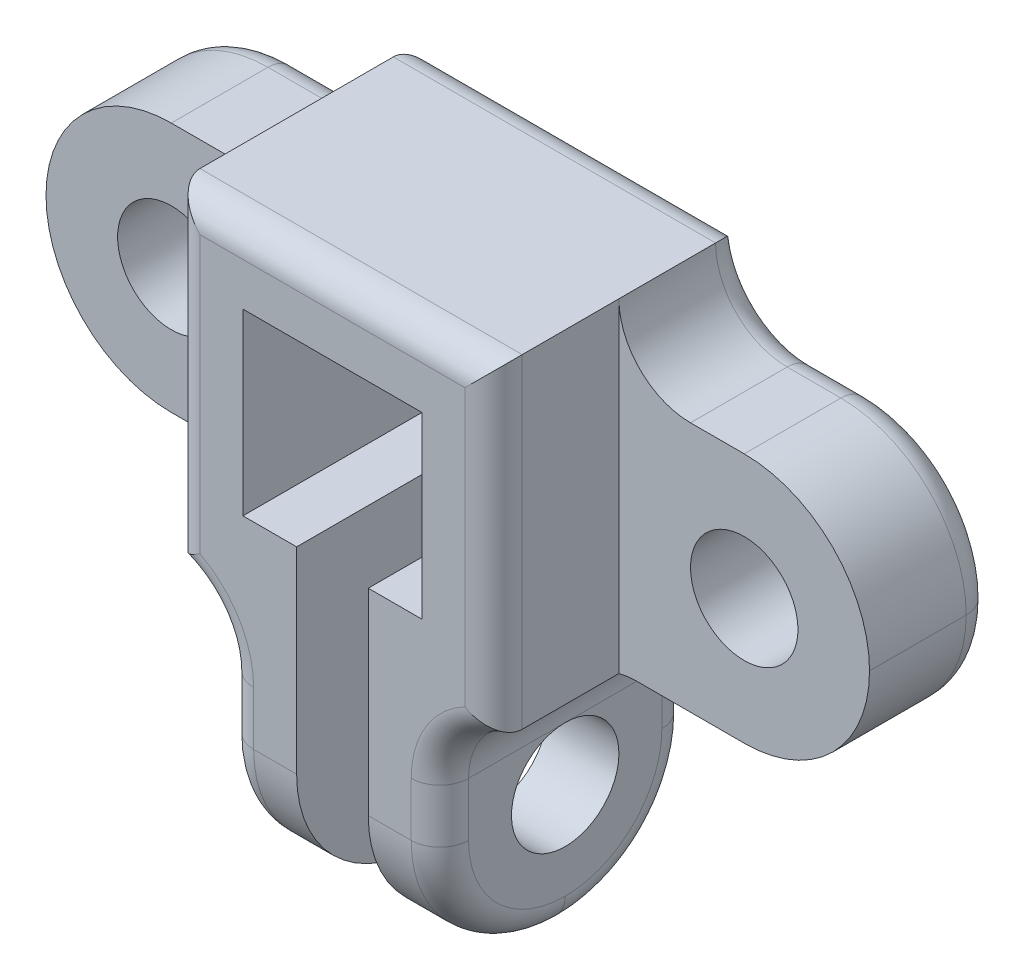
from build123d import *

# Parameters (mm, degrees)
EXTRUDE_1_DEPTH     = 7
CUT_EXTRUDE_1_DEPTH = 3.5
FILLET_1_R          = 3.5
SKETCH_3_R          = 1.4999999999999996
CUT_EXTRUDE_2_DEPTH = 17.635804759614125
SKETCH_4_R          = 1.5000000000000002
CUT_EXTRUDE_3_DEPTH = 20.786358937409375
FILLET_2_R          = 2
FILLET_3_R          = 2
FILLET_4_R          = 0.8


# Some blends are built 0.0001 mm under size
with BuildPart() as part:
    # 草图1 → 凸台-拉伸1 (new body)
    with BuildSketch(Plane.XY):
        Polygon((-2.5000000000000004, -2.4999999999999996), (-2.5000000000000013, 2.5000000000000004), (-4.499999999999999, 2.4999999999999996), (-4.499999999999999, -4.500000000000002), (-2.9999999999999973, -4.500000000000002), (-0.9999999999999982, -4.500000000000002), (-0.9999999999999986, -2.4999999999999987), align=None)
        Polygon((-4.499999999999999, 2.4999999999999996), (-2.5000000000000013, 2.5000000000000004), (2.4999999999999987, 2.5000000000000004), (4.500000000000001, 2.4999999999999996), (4.500000000000001, 4.499999999999998), (-4.499999999999999, 4.499999999999998), align=None)
        Polygon((4.500000000000001, 2.4999999999999996), (2.4999999999999987, 2.5000000000000004), (2.4999999999999996, -2.4999999999999996), (0.9999999999999987, -2.4999999999999996), (0.9999999999999982, -4.500000000000002), (2.9999999999999973, -4.500000000000002), (4.500000000000001, -4.500000000000002), align=None)
        Polygon((-0.9999999999999982, -4.500000000000002), (-2.9999999999999973, -4.500000000000002), (-2.9999999999999973, -11.500000000000004), (-0.9999999999999972, -11.500000000000004), align=None)
        Polygon((2.9999999999999973, -4.500000000000002), (0.9999999999999982, -4.500000000000002), (0.9999999999999972, -11.500000000000004), (2.9999999999999973, -11.500000000000004), align=None)
        Polygon((-4.499999999999999, -4.500000000000002), (-4.499999999999999, 2.4999999999999996), (-11.499999999999996, 2.499999999999997), (-11.499999999999996, -4.5000000000000036), align=None)
        Polygon((11.499999999999996, 2.499999999999997), (4.500000000000001, 2.4999999999999996), (4.500000000000002, -4.500000000000002), (11.499999999999996, -4.5000000000000036), align=None)
    extrude(amount=EXTRUDE_1_DEPTH)

    # 草图2 → 切除-拉伸1 (cut)
    with BuildSketch(Plane.XY.offset(7)):
        Polygon((-4.499999999999999, 2.4999999999999996), (-4.499999999999999, -4.500000000000002), (-11.499999999999996, -4.5000000000000036), (-11.499999999999996, 2.499999999999997), align=None)
        Polygon((4.500000000000001, 2.5), (4.500000000000001, -4.500000000000002), (11.499999999999996, -4.5000000000000036), (11.499999999999996, 2.499999999999997), align=None)
    extrude(amount=-CUT_EXTRUDE_1_DEPTH, mode=Mode.SUBTRACT)

    # 圆角1
    fillet_1_edges = [part.edges().sort_by_distance(p)[0] for p in [
        (1.9999999999999973, -11.500000000000004, 0),
        (1.9999999999999973, -11.500000000000004, 7),
        (-1.9999999999999973, -11.500000000000004, 0),
        (-1.9999999999999973, -11.500000000000004, 7),
        (11.499999999999996, -4.5000000000000036, 1.75),
        (11.499999999999996, 2.499999999999997, 1.75),
        (-11.499999999999996, -4.5000000000000036, 1.75),
        (-11.499999999999996, 2.499999999999997, 1.75),
    ]]
    fillet(fillet_1_edges, radius=FILLET_1_R - 0.0001)  # a hair under: the kernel refuses the full size

    # 草图3 → 切除-拉伸2 (cut, through all)
    with BuildSketch(Plane.XY.offset(3.5)):
        with Locations((-7.9999999999999964, -1.0000000000000013)):
            Circle(SKETCH_3_R)
        with Locations(Location((7.9999999999999964, -1.0000000000000013, 0), (0, 0, 180))):
            Circle(SKETCH_3_R)
    extrude(amount=-CUT_EXTRUDE_2_DEPTH, mode=Mode.SUBTRACT)

    # 草图4 → 切除-拉伸3 (cut, through all)
    with BuildSketch(Plane.ZY.offset(2.9999999999999973)):
        with Locations((3.5, -8.000000000000004)):
            Circle(SKETCH_4_R)
    extrude(amount=-CUT_EXTRUDE_3_DEPTH, mode=Mode.SUBTRACT)

    # 圆角2
    fillet_2_edges = [part.edges().sort_by_distance(p)[0] for p in [
        (4.500000000000001, 2.4999999999999996, 1.75),
        (-4.499999999999999, 2.4999999999999996, 1.75),
    ]]
    fillet(fillet_2_edges, radius=FILLET_2_R - 0.0001)  # a hair under: the kernel refuses the full size

    # 圆角3
    fillet_3_edges = [part.edges().sort_by_distance(p)[0] for p in [
        (2.9999999999999973, -4.500000000000002, 3.5),
        (-2.9999999999999973, -4.500000000000002, 3.5),
    ]]
    fillet(fillet_3_edges, radius=FILLET_3_R)

    # 圆角4
    # the kernel refuses this fillet: 0.8 mm, written as the material it takes off along each edge
    with BuildSketch(Plane(origin=(-2.9999999999999973, -6.500000000000002, 0), x_dir=(1, 0, 0), z_dir=(0, -1, 0))) as fillet_4_piece_1:
        with BuildLine():
            CenterArc((FILLET_4_R, FILLET_4_R), FILLET_4_R, 180, 90)
            Line((0, FILLET_4_R), (0, 0))
            Line((0, 0), (FILLET_4_R, 0))
        make_face()
    extrude(amount=1.5001000000000015, mode=Mode.SUBTRACT)
    with BuildSketch(Plane(origin=(-4.9999999999999964, -4.500000000000002, 0), x_dir=(-2.1e-16, 1, 0), z_dir=(-1, -2.1e-16, 0)), Plane(origin=(8.000099999999996, -4.500000000000003, 0), x_dir=(2.1e-16, 1, 0), z_dir=(-1, 2.1e-16, 0))) as fillet_4_piece_2:
        with BuildLine():
            CenterArc((FILLET_4_R, -FILLET_4_R), FILLET_4_R, 90, 90)
            Line((0, -FILLET_4_R), (0, 0))
            Line((0, 0), (FILLET_4_R, 0))
        make_face()
    extrude(amount=3.0000999999999998, mode=Mode.SUBTRACT)
    with BuildSketch(Plane(origin=(-8.000099999999996, -0.9999000000000016, 0), x_dir=(-1, -6e-17, 0), z_dir=(6e-17, -1, 0))) as fillet_4_piece_3:
        with BuildLine():
            CenterArc((3.4999000000000002 - FILLET_4_R, -FILLET_4_R), FILLET_4_R, 7.95e-15, 90)
            Line((3.4999000000000002, -FILLET_4_R), (3.4999000000000002, 0))
            Line((3.4999000000000002, 0), (3.4999000000000002 - FILLET_4_R, 0))
        make_face()
    revolve(axis=Axis((-8.000099999999996, -0.9999000000000016, 0), (0, 0, -1)), revolution_arc=90, mode=Mode.SUBTRACT)
    with BuildSketch(Plane(origin=(-8.000099999999996, -1.0001000000000024, 0), x_dir=(0, -1, 0), z_dir=(1, 0, 0))) as fillet_4_piece_4:
        with BuildLine():
            CenterArc((3.4998999999999993 - FILLET_4_R, -FILLET_4_R), FILLET_4_R, 7.95e-15, 90)
            Line((3.4998999999999993, -FILLET_4_R), (3.4998999999999993, 0))
            Line((3.4998999999999993, 0), (3.4998999999999993 - FILLET_4_R, 0))
        make_face()
    revolve(axis=Axis((-8.000099999999996, -1.0001000000000024, 0), (0, 0, -1)), revolution_arc=90, mode=Mode.SUBTRACT)
    with BuildSketch(Plane(origin=(8.000099999999996, -0.999900000000002, 0), x_dir=(1, -6e-17, 0), z_dir=(-6e-17, -1, 0))) as fillet_4_piece_5:
        with BuildLine():
            CenterArc((3.4999000000000002 - FILLET_4_R, FILLET_4_R), FILLET_4_R, 270, 89.99999999999999)
            Line((3.4999000000000002, FILLET_4_R), (3.4999000000000002, 0))
            Line((3.4999000000000002, 0), (3.4999000000000002 - FILLET_4_R, 0))
        make_face()
    revolve(axis=Axis((8.000099999999996, -0.999900000000002, 0), (0, 0, 1)), revolution_arc=89.99999999999997, mode=Mode.SUBTRACT)
    with BuildSketch(Plane(origin=(8.000099999999996, -1.0001000000000024, 0), x_dir=(1, 1.9e-16, 0), z_dir=(-1.9e-16, 1, 0))) as fillet_4_piece_6:
        with BuildLine():
            CenterArc((3.4999000000000002 - FILLET_4_R, -FILLET_4_R), FILLET_4_R, 7.95e-15, 90)
            Line((3.4999000000000002, -FILLET_4_R), (3.4999000000000002, 0))
            Line((3.4999000000000002, 0), (3.4999000000000002 - FILLET_4_R, 0))
        make_face()
    revolve(axis=Axis((8.000099999999996, -1.0001000000000024, 0), (0, 0, -1)), revolution_arc=90, mode=Mode.SUBTRACT)
    with BuildSketch(Plane(origin=(-2.9999999999999973, -6.500000000000002, 7), x_dir=(1, 0, 0), z_dir=(0, -1, 0))) as fillet_4_piece_7:
        with BuildLine():
            CenterArc((FILLET_4_R, -FILLET_4_R), FILLET_4_R, 90, 90)
            Line((0, -FILLET_4_R), (0, 0))
            Line((0, 0), (FILLET_4_R, 0))
        make_face()
    extrude(amount=1.5001000000000015, mode=Mode.SUBTRACT)
    with BuildSketch(Plane(origin=(-2.9999999999999973, -8.000100000000003, 3.5001000000000007), x_dir=(0, 0, 1), z_dir=(0, 1, 0))) as fillet_4_piece_8:
        with BuildLine():
            CenterArc((3.4998999999999993 - FILLET_4_R, FILLET_4_R), FILLET_4_R, 270, 90)
            Line((3.4998999999999993, FILLET_4_R), (3.4998999999999993, 0))
            Line((3.4998999999999993, 0), (3.4998999999999993 - FILLET_4_R, 0))
        make_face()
    revolve(axis=Axis((-2.9999999999999973, -8.000100000000003, 3.5001000000000007), (1, 0, 0)), revolution_arc=90, mode=Mode.SUBTRACT)
    with BuildSketch(Plane(origin=(-2.9999999999999973, -8.000100000000003, 3.4998999999999993), x_dir=(0, -1, 0), z_dir=(0, 0, 1))) as fillet_4_piece_9:
        with BuildLine():
            CenterArc((3.4999000000000002 - FILLET_4_R, FILLET_4_R), FILLET_4_R, 270, 90)
            Line((3.4999000000000002, FILLET_4_R), (3.4999000000000002, 0))
            Line((3.4999000000000002, 0), (3.4999000000000002 - FILLET_4_R, 0))
        make_face()
    revolve(axis=Axis((-2.9999999999999973, -8.000100000000003, 3.4998999999999993), (1, 0, 0)), revolution_arc=90, mode=Mode.SUBTRACT)
    with BuildSketch(Plane(origin=(8.000099999999998, 2.4999999999999982, 0), x_dir=(-3.8e-16, -1, 0), z_dir=(-1, 3.8e-16, 0))) as fillet_4_piece_10:
        with BuildLine():
            CenterArc((FILLET_4_R, FILLET_4_R), FILLET_4_R, 180, 90)
            Line((0, FILLET_4_R), (0, 0))
            Line((0, 0), (FILLET_4_R, 0))
        make_face()
    extrude(amount=1.5001999999999978, mode=Mode.SUBTRACT)
    with BuildSketch(Plane(origin=(-6.4998999999999985, 2.4999999999999987, 0), x_dir=(3.8e-16, -1, 0), z_dir=(-1, -3.8e-16, 0))) as fillet_4_piece_11:
        with BuildLine():
            CenterArc((FILLET_4_R, FILLET_4_R), FILLET_4_R, 180, 90)
            Line((-4.4e-16, FILLET_4_R), (0, 0))
            Line((0, 0), (FILLET_4_R, 0))
        make_face()
    extrude(amount=1.5001999999999978, mode=Mode.SUBTRACT)
    with BuildSketch(Plane(origin=(6.499900000000001, 4.4998999999999985, 0), x_dir=(-1, 0, 0), z_dir=(0, 1, 0))) as fillet_4_piece_12:
        with BuildLine():
            CenterArc((1.9999000000000002 + FILLET_4_R, FILLET_4_R), FILLET_4_R, 180, 90)
            Line((1.9999000000000002, FILLET_4_R), (1.9999000000000002, 0))
            Line((1.9999000000000002, 0), (1.9999000000000002 + FILLET_4_R, 0))
        make_face()
    revolve(axis=Axis((6.499900000000001, 4.4998999999999985, 0), (0, 0, 1)), revolution_arc=89.99999999999994, mode=Mode.SUBTRACT)
    with BuildSketch(Plane(origin=(-6.499899999999999, 4.4998999999999985, 0), x_dir=(1, 0, 0), z_dir=(0, 1, 0))) as fillet_4_piece_13:
        with BuildLine():
            CenterArc((1.9999000000000002 + FILLET_4_R, -FILLET_4_R), FILLET_4_R, 90, 90)
            Line((1.9999000000000002, -FILLET_4_R), (1.9999000000000002, 0))
            Line((1.9999000000000002, 0), (1.9999000000000002 + FILLET_4_R, 0))
        make_face()
    revolve(axis=Axis((-6.499899999999999, 4.4998999999999985, 0), (0, 0, -1)), revolution_arc=89.99999999999994, mode=Mode.SUBTRACT)
    with BuildSketch(Plane(origin=(4.9999999999999964, -6.500000000000002, 0), x_dir=(-1, 0, 0), z_dir=(0, -1, 0))) as fillet_4_piece_14:
        with BuildLine():
            CenterArc((2 + FILLET_4_R, -FILLET_4_R), FILLET_4_R, 90, 90)
            Line((1.9999999999999991, -FILLET_4_R), (2, 0))
            Line((2, 0), (2 + FILLET_4_R, 0))
        make_face()
    revolve(axis=Axis((4.9999999999999964, -6.500000000000002, 0), (0, 0, -1)), revolution_arc=90, mode=Mode.SUBTRACT)
    with BuildSketch(Plane(origin=(4.9999999999999964, -6.500000000000002, 7), x_dir=(-1, 0, 0), z_dir=(0, -1, 0))) as fillet_4_piece_15:
        with BuildLine():
            CenterArc((2 + FILLET_4_R, FILLET_4_R), FILLET_4_R, 180, 90)
            Line((1.9999999999999991, FILLET_4_R), (2, 0))
            Line((2, 0), (2 + FILLET_4_R, 0))
        make_face()
    revolve(axis=Axis((4.9999999999999964, -6.500000000000002, 7), (0, 0, -1)), revolution_arc=132.8344729120862, mode=Mode.SUBTRACT)
    with BuildSketch(Plane(origin=(-4.9999999999999964, -6.500000000000002, 0), x_dir=(0, 1, 0), z_dir=(-1, 0, 0))) as fillet_4_piece_16:
        with BuildLine():
            CenterArc((2 + FILLET_4_R, -FILLET_4_R), FILLET_4_R, 90, 90)
            Line((2 + FILLET_4_R, 1.1e-16), (2, 0))
            Line((2, 0), (2, -FILLET_4_R))
        make_face()
    revolve(axis=Axis((-4.9999999999999964, -6.500000000000002, 0), (0, 0, -1)), revolution_arc=90, mode=Mode.SUBTRACT)
    with BuildSketch(Plane(origin=(-4.9999999999999964, -6.500000000000002, 7), x_dir=(-0.679882641435008, 0.7333209351132398, 0), z_dir=(-0.7333209351132398, -0.679882641435008, 0))) as fillet_4_piece_17:
        with BuildLine():
            CenterArc((1.9999999999999993 + FILLET_4_R, FILLET_4_R), FILLET_4_R, 180, 90)
            Line((1.9999999999999991, FILLET_4_R), (1.9999999999999993, 0))
            Line((1.9999999999999993, 0), (1.9999999999999993 + FILLET_4_R, 0))
        make_face()
    revolve(axis=Axis((-4.9999999999999964, -6.500000000000002, 7), (0, 0, -1)), revolution_arc=132.83447291208606, mode=Mode.SUBTRACT)
    with BuildSketch(Plane(origin=(6.500000000000002, 4.499999999999998, 0), x_dir=(0, 0, 1), z_dir=(-1, 0, 0))) as fillet_4_piece_18:
        with BuildLine():
            CenterArc((FILLET_4_R, -FILLET_4_R), FILLET_4_R, 90, 90)
            Line((-1.1e-16, -FILLET_4_R), (0, 0))
            Line((0, 0), (FILLET_4_R, 0))
        make_face()
    extrude(amount=13, mode=Mode.SUBTRACT)
    with BuildSketch(Plane(origin=(4.500000000000002, -6.563508326896292, 7), x_dir=(-1, 0, 0), z_dir=(0, 1, 0))) as fillet_4_piece_19:
        with BuildLine():
            CenterArc((FILLET_4_R, -FILLET_4_R), FILLET_4_R, 90, 90)
            Line((-8.9e-16, -FILLET_4_R), (0, 0))
            Line((0, 0), (FILLET_4_R, 0))
        make_face()
    extrude(amount=13.06350832689629, mode=Mode.SUBTRACT)
    with BuildSketch(Plane(origin=(6.500000000000002, 4.499999999999998, 7), x_dir=(0, -1, 0), z_dir=(-1, 0, 0))) as fillet_4_piece_20:
        with BuildLine():
            CenterArc((FILLET_4_R, -FILLET_4_R), FILLET_4_R, 90, 90)
            Line((0, -FILLET_4_R), (0, 0))
            Line((0, 0), (FILLET_4_R, 0))
        make_face()
    extrude(amount=13, mode=Mode.SUBTRACT)
    with BuildSketch(Plane(origin=(-4.499999999999999, 6.499999999999998, 7), x_dir=(0, 0, -1), z_dir=(0, -1, 0))) as fillet_4_piece_21:
        with BuildLine():
            CenterArc((FILLET_4_R, FILLET_4_R), FILLET_4_R, 180, 90)
            Line((0, FILLET_4_R), (0, 0))
            Line((0, 0), (FILLET_4_R, 0))
        make_face()
    extrude(amount=13.063508326896292, mode=Mode.SUBTRACT)
    with BuildSketch(Plane(origin=(2.9999999999999973, -8.000100000000003, 0), x_dir=(-1, 0, 0), z_dir=(0, 1, 0))) as fillet_4_piece_22:
        with BuildLine():
            CenterArc((FILLET_4_R, FILLET_4_R), FILLET_4_R, 180, 90)
            Line((0, FILLET_4_R), (0, 0))
            Line((0, 0), (FILLET_4_R, 0))
        make_face()
    extrude(amount=1.5001000000000015, mode=Mode.SUBTRACT)
    with BuildSketch(Plane(origin=(2.9999999999999973, -8.000100000000003, 7), x_dir=(-1, 0, 0), z_dir=(0, 1, 0))) as fillet_4_piece_23:
        with BuildLine():
            CenterArc((FILLET_4_R, -FILLET_4_R), FILLET_4_R, 90, 90)
            Line((0, -FILLET_4_R), (0, 0))
            Line((0, 0), (FILLET_4_R, 0))
        make_face()
    extrude(amount=1.5001000000000015, mode=Mode.SUBTRACT)
    with BuildSketch(Plane(origin=(2.9999999999999973, -8.000100000000003, 3.5001000000000007), x_dir=(0, 0, 1), z_dir=(0, 1, 0))) as fillet_4_piece_24:
        with BuildLine():
            CenterArc((3.4998999999999993 - FILLET_4_R, -FILLET_4_R), FILLET_4_R, 0, 90)
            Line((3.4998999999999993, -FILLET_4_R), (3.4998999999999993, 0))
            Line((3.4998999999999993, 0), (3.4998999999999993 - FILLET_4_R, 0))
        make_face()
    revolve(axis=Axis((2.9999999999999973, -8.000100000000003, 3.5001000000000007), (1, 0, 0)), revolution_arc=90, mode=Mode.SUBTRACT)
    with BuildSketch(Plane(origin=(2.9999999999999973, -8.000100000000003, 3.4998999999999993), x_dir=(0, -1, 0), z_dir=(0, 0, 1))) as fillet_4_piece_25:
        with BuildLine():
            CenterArc((3.4999000000000002 - FILLET_4_R, -FILLET_4_R), FILLET_4_R, 0, 90)
            Line((3.4999000000000002, -FILLET_4_R), (3.4999000000000002, 0))
            Line((3.4999000000000002, 0), (3.4999000000000002 - FILLET_4_R, 0))
        make_face()
    revolve(axis=Axis((2.9999999999999973, -8.000100000000003, 3.4998999999999993), (1, 0, 0)), revolution_arc=90, mode=Mode.SUBTRACT)
    with BuildSketch(Plane(origin=(2.9999999999999973, -11.500000000000004, 3.4998999999999993), x_dir=(0, 1, 0), z_dir=(0, 0, 1))) as fillet_4_piece_26:
        with BuildLine():
            CenterArc((FILLET_4_R, FILLET_4_R), FILLET_4_R, 180, 90)
            Line((0, FILLET_4_R), (0, 0))
            Line((0, 0), (FILLET_4_R, 0))
        make_face()
    extrude(amount=0.00020000000000131, mode=Mode.SUBTRACT)
    with BuildSketch(Plane(origin=(-4.499999999999999, 4.4998999999999985, 0), x_dir=(0, 0, 1), z_dir=(0, 1, 0))) as fillet_4_piece_27:
        with BuildLine():
            CenterArc((FILLET_4_R, FILLET_4_R), FILLET_4_R, 180, 90)
            Line((-1.1e-16, FILLET_4_R), (0, 0))
            Line((0, 0), (FILLET_4_R, 0))
        make_face()
    extrude(amount=2.0000999999999998, mode=Mode.SUBTRACT)
    with BuildSketch(Plane(origin=(4.5, 6.499999999999998, 0), x_dir=(-1, -1e-16, 0), z_dir=(1e-16, -1, 0))) as fillet_4_piece_28:
        with BuildLine():
            CenterArc((FILLET_4_R, -FILLET_4_R), FILLET_4_R, 90, 90)
            Line((-8.9e-16, -FILLET_4_R), (0, 0))
            Line((0, 0), (FILLET_4_R, 0))
        make_face()
    extrude(amount=2.0001000000000007, mode=Mode.SUBTRACT)
    with BuildSketch(Plane(origin=(-2.9999999999999973, -11.500000000000004, 3.4998999999999993), x_dir=(0, 1, 0), z_dir=(0, 0, 1))) as fillet_4_piece_29:
        with BuildLine():
            CenterArc((FILLET_4_R, -FILLET_4_R), FILLET_4_R, 90, 90)
            Line((0, -FILLET_4_R), (0, 0))
            Line((0, 0), (FILLET_4_R, 0))
        make_face()
    extrude(amount=0.00020000000000131, mode=Mode.SUBTRACT)
    with BuildSketch(Plane(origin=(11.499999999999996, -1.0001000000000024, 0), x_dir=(-1, 0, 0), z_dir=(0, 1, 0))) as fillet_4_piece_30:
        with BuildLine():
            CenterArc((FILLET_4_R, FILLET_4_R), FILLET_4_R, 180, 90)
            Line((0, FILLET_4_R), (0, 0))
            Line((0, 0), (FILLET_4_R, 0))
        make_face()
    extrude(amount=0.00020000000000042, mode=Mode.SUBTRACT)
    with BuildSketch(Plane(origin=(-11.499999999999996, -0.9999000000000016, 0), x_dir=(1, 0, 0), z_dir=(0, -1, 0))) as fillet_4_piece_31:
        with BuildLine():
            CenterArc((FILLET_4_R, FILLET_4_R), FILLET_4_R, 180, 90)
            Line((0, FILLET_4_R), (0, 0))
            Line((0, 0), (FILLET_4_R, 0))
        make_face()
    extrude(amount=0.00020000000000131, mode=Mode.SUBTRACT)


solid = part.part
